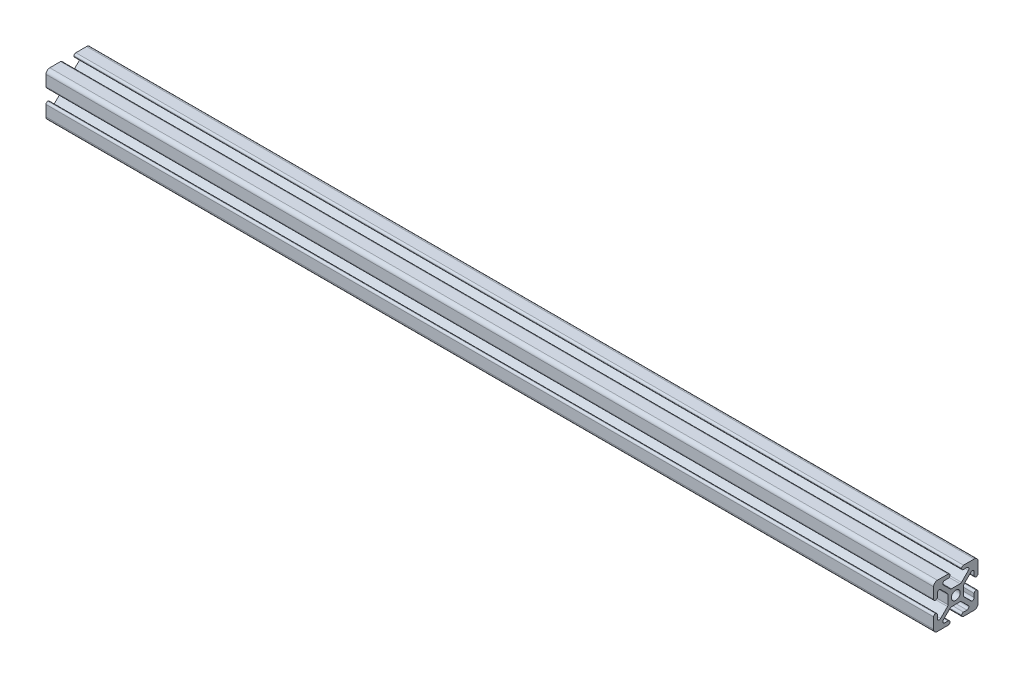
from build123d import *

# Parameters (mm, degrees)
SKETCH1_R           = 2.5
BOSS_EXTRUDE1_DEPTH = 500
FILLET1_R           = 1.065
FILLET2_R           = 2.13


with BuildPart() as part:
    # Sketch1 → Boss-Extrude1 (new body)
    with BuildSketch(Plane.YZ):
        Polygon((-12.5, -3.25), (-12.5, -12.5), (-3.25, -12.5), (-3.25, -10.37), (-8.863862556, -10.37), (-2.873862556, -4.38), (2.873862556, -4.38), (8.863862556, -10.37), (3.25, -10.37), (3.25, -12.5), (12.5, -12.5), (12.5, -3.25), (10.37, -3.25), (10.37, -8.863862556), (4.38, -2.873862556), (4.38, 2.873862556), (10.37, 8.863862556), (10.37, 3.25), (12.5, 3.25), (12.5, 12.5), (3.25, 12.5), (3.25, 10.37), (8.863862556, 10.37), (2.873862556, 4.38), (-2.873862556, 4.38), (-8.863862556, 10.37), (-3.25, 10.37), (-3.25, 12.5), (-12.5, 12.5), (-12.5, 3.25), (-10.37, 3.25), (-10.37, 8.863862556), (-4.38, 2.873862556), (-4.38, -2.873862556), (-10.37, -8.863862556), (-10.37, -3.25), align=None)
        with Locations(Location((0, 0, 0), (0, 0, 270))):
            Circle(SKETCH1_R, mode=Mode.SUBTRACT)
    extrude(amount=BOSS_EXTRUDE1_DEPTH)

    # Fillet1
    fillet1_edges = [part.edges().sort_by_distance(p)[0] for p in [
        (250, -10.37, -8.863862556),
        (250, 2.873862556, -4.38),
        (250, -2.873862556, -4.38),
        (250, -4.38, 2.873862556),
        (250, -4.38, -2.873862556),
        (250, -2.873862556, 4.38),
        (250, 2.873862556, 4.38),
        (250, 4.38, 2.873862556),
        (250, 4.38, -2.873862556),
        (250, -8.863862556, -10.37),
        (250, 8.863862556, -10.37),
        (250, 10.37, -8.863862556),
        (250, -10.37, 8.863862556),
        (250, -8.863862556, 10.37),
        (250, 10.37, 8.863862556),
        (250, 8.863862556, 10.37),
        (250, 12.5, 3.25),
        (250, -3.25, -12.5),
        (250, -10.37, 3.25),
        (250, 10.37, 3.25),
        (250, -10.37, -3.25),
        (250, -12.5, -3.25),
        (250, -12.5, 3.25),
        (250, 3.25, -10.37),
        (250, -3.25, -10.37),
        (250, 3.25, -12.5),
        (250, 10.37, -3.25),
        (250, 12.5, -3.25),
        (250, 3.25, 12.5),
        (250, 3.25, 10.37),
        (250, -3.25, 10.37),
        (250, -3.25, 12.5),
    ]]
    fillet(fillet1_edges, radius=FILLET1_R - 0.0001)  # a hair under: the kernel refuses the full size

    # Fillet2
    fillet2_edges = [part.edges().sort_by_distance(p)[0] for p in [
        (250, -12.5, 12.5),
        (250, 12.5, 12.5),
        (250, 12.5, -12.5),
        (250, -12.5, -12.5),
    ]]
    fillet(fillet2_edges, radius=FILLET2_R)


solid = part.part
